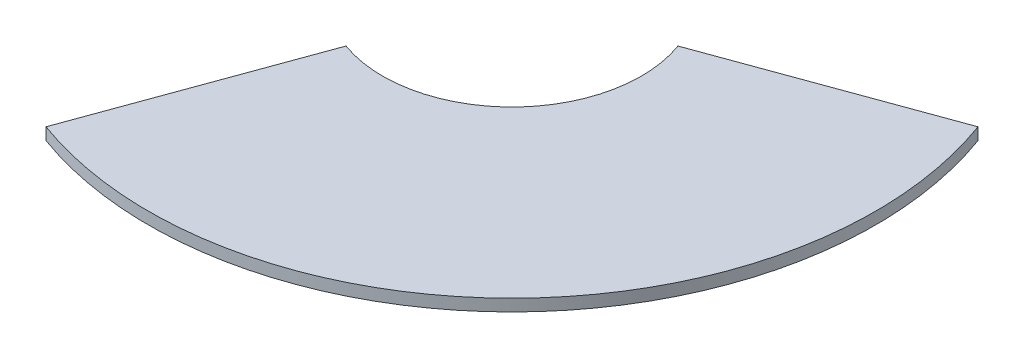
from build123d import *

# Parameters (mm, degrees)
BOSS_EXTRUDE2_DEPTH = 3


with BuildPart() as part:
    # Sketch2 → Boss-Extrude2 (new body)
    with BuildSketch(Plane(origin=(0, 0, 0), x_dir=(1, 0, 0), z_dir=(0, 1, 0))):
        with BuildLine():
            ThreePointArc((32.5, 0), (18.641234181, -26.622441439), (-11.115654658, -30.540010176))
            Line((-11.115654658, -30.540010176), (-31.214896923, -85.762224446))
            ThreePointArc((-31.214896923, -85.762224446), (52.34817214, -74.760937698), (91.266252973, 0))
            ThreePointArc((91.266252973, 0), (89.879713516, 15.848218511), (85.762224446, 31.214896923))
            Line((85.762224446, 31.214896923), (30.540010176, 11.115654658))
            ThreePointArc((30.540010176, 11.115654658), (32.006251973, 5.643565774), (32.5, 0))
        make_face()
    extrude(amount=BOSS_EXTRUDE2_DEPTH)


solid = part.part
